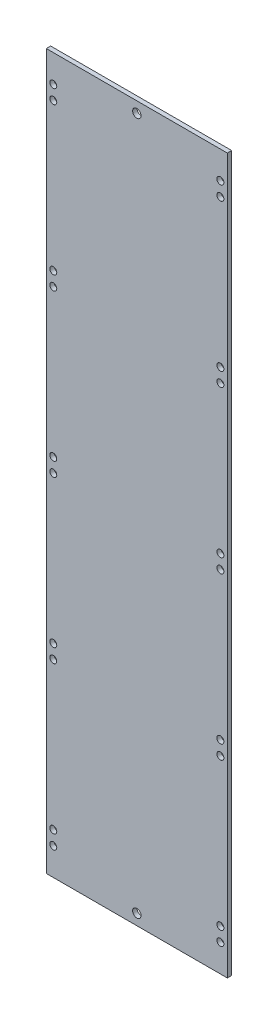
from build123d import *

# Parameters (mm, degrees)
SKETCH1_W           = 83
SKETCH1_H           = 327.5
BOSS_EXTRUDE1_DEPTH = 2
SKETCH2_R           = 1.6
CUT_EXTRUDE1_DEPTH  = 2
SKETCH3_R           = 1.93
CUT_EXTRUDE2_DEPTH  = 2


with BuildPart() as part:
    # Sketch1 → Boss-Extrude1 (new body)
    with BuildSketch(Plane.XY):
        with Locations((41.5, 163.75)):
            Rectangle(SKETCH1_W, SKETCH1_H)
    extrude(amount=BOSS_EXTRUDE1_DEPTH)

    # Sketch2 → Cut-Extrude1 (cut)
    with BuildSketch(Plane.XY.offset(2)):
        with Locations((3.2, 314.9)):
            Circle(SKETCH2_R)
        with Locations((3.2, 308.5)):
            Circle(SKETCH2_R)
        with Locations((79.8, 314.9)):
            Circle(SKETCH2_R)
        with Locations((79.8, 308.5)):
            Circle(SKETCH2_R)
        with Locations((3.2, 240.925)):
            Circle(SKETCH2_R)
        with Locations((3.2, 234.525)):
            Circle(SKETCH2_R)
        with Locations((79.8, 240.925)):
            Circle(SKETCH2_R)
        with Locations((79.8, 234.525)):
            Circle(SKETCH2_R)
        with Locations((3.2, 166.95)):
            Circle(SKETCH2_R)
        with Locations((3.2, 160.55)):
            Circle(SKETCH2_R)
        with Locations((79.8, 166.95)):
            Circle(SKETCH2_R)
        with Locations((79.8, 160.55)):
            Circle(SKETCH2_R)
        with Locations((3.2, 92.975)):
            Circle(SKETCH2_R)
        with Locations((3.2, 86.575)):
            Circle(SKETCH2_R)
        with Locations((79.8, 92.975)):
            Circle(SKETCH2_R)
        with Locations((79.8, 86.575)):
            Circle(SKETCH2_R)
        with Locations((3.2, 19)):
            Circle(SKETCH2_R)
        with Locations((3.2, 12.6)):
            Circle(SKETCH2_R)
        with Locations((79.8, 19)):
            Circle(SKETCH2_R)
        with Locations((79.8, 12.6)):
            Circle(SKETCH2_R)
    extrude(amount=-CUT_EXTRUDE1_DEPTH, mode=Mode.SUBTRACT)

    # Sketch3 → Cut-Extrude2 (cut)
    with BuildSketch(Plane.XY.offset(2)):
        with Locations((41.5, 322.524)):
            Circle(SKETCH3_R)
        with Locations((41.5, 4.976)):
            Circle(SKETCH3_R)
    extrude(amount=-CUT_EXTRUDE2_DEPTH, mode=Mode.SUBTRACT)


solid = part.part
